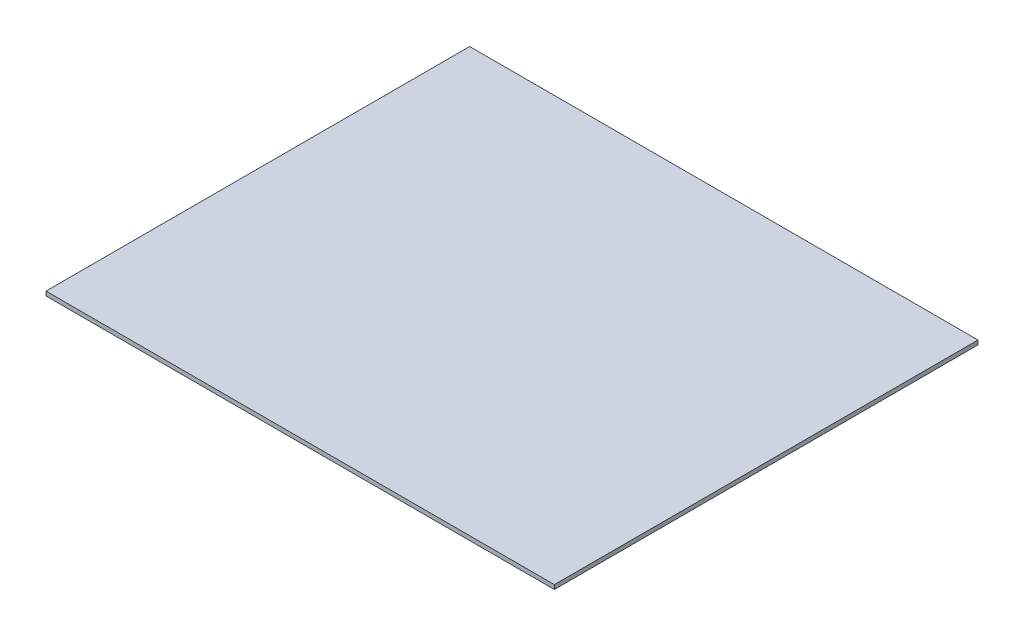
from build123d import *

# Parameters (mm, degrees)
SKETCH1_W           = 381
SKETCH1_H           = 317.5
BOSS_EXTRUDE1_DEPTH = 3.175


with BuildPart() as part:
    # Sketch1 → Boss-Extrude1 (new body)
    with BuildSketch(Plane(origin=(0, 0, 0), x_dir=(1, 0, 0), z_dir=(0, 1, 0))):
        Rectangle(SKETCH1_W, SKETCH1_H)
    extrude(amount=BOSS_EXTRUDE1_DEPTH)


solid = part.part
